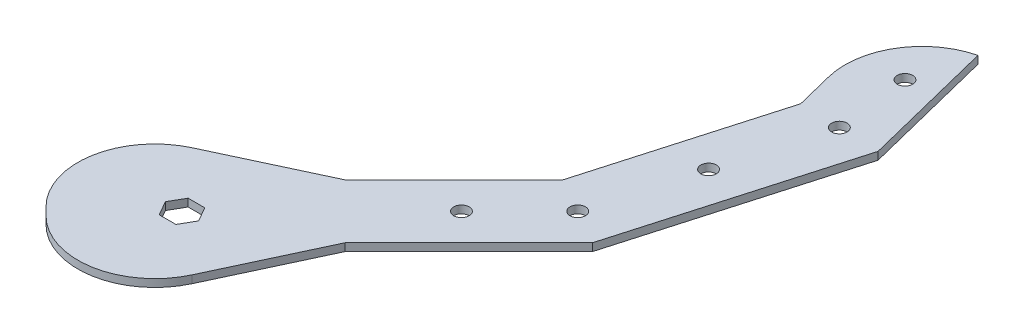
from build123d import *

# Parameters (mm, degrees)
BOSS_EXTRUDE1_DEPTH        = 2.54
FILLET3_R                  = 25.4
F_10_CLEARANCE_HOLE1_D     = 5.1054
F_10_CLEARANCE_HOLE1_DEPTH = 9.906
F_10_CLEARANCE_HOLE1_TIP   = 1.533816902
FILLET4_R                  = 25.4


with BuildPart() as part:
    # Sketch1 → Boss-Extrude1 (new body)
    with BuildSketch(Plane(origin=(0, 0, 0), x_dir=(1, 0, 0), z_dir=(0, 1, 0))):
        Polygon((38.706788555, 38.706788555), (79.551048595, 79.551048595), (100.554615109, 152.799189826), (89.598560117, 196.741526293), (64.953048669, 190.596710145), (74.170272892, 153.628442974), (56.667300797, 92.588325282), (20.746276313, 56.667300797), (-46.605644595, 25.236404374), (7.275892132, -28.645132353), align=None)
        Polygon((8.285025385, 20.746276313), (5.535394728, 25.508776313), (0.036133414, 25.508776313), (-2.713497243, 20.746276313), (0.036133414, 15.983776313), (5.535394728, 15.983776313), align=None, mode=Mode.SUBTRACT)
    extrude(amount=BOSS_EXTRUDE1_DEPTH)

    # Fillet3
    fillet3_edges = [part.edges().sort_by_distance(p)[0] for p in [
        (64.953048669, 1.27, -190.596710145),
    ]]
    fillet(fillet3_edges, radius=FILLET3_R - 0.0001)  # a hair under: the kernel refuses the full size

    # #10 Clearance Hole1
    with Locations(Plane(origin=(0, 2.54, 0), x_dir=(1, 0, 0), z_dir=(0, 1, 0))):
        with Locations((84.531663752, 177.691526293), (87.362444, 153.2138164), (77.735809348, 119.641751669), (68.109174696, 86.069686939), (48.917853565, 66.878365807)):
            Hole(F_10_CLEARANCE_HOLE1_D / 2, depth=F_10_CLEARANCE_HOLE1_DEPTH)
            with Locations((0, 0, -(F_10_CLEARANCE_HOLE1_DEPTH + F_10_CLEARANCE_HOLE1_TIP / 2))):  # 118° drill point
                Cone(0, F_10_CLEARANCE_HOLE1_D / 2, F_10_CLEARANCE_HOLE1_TIP, mode=Mode.SUBTRACT)

    # Fillet4
    fillet4_edges = [part.edges().sort_by_distance(p)[0] for p in [
        (7.275892132, 1.27, 28.645132353),
        (-46.605644595, 1.27, -25.236404374),
    ]]
    fillet(fillet4_edges, radius=FILLET4_R)


solid = part.part
